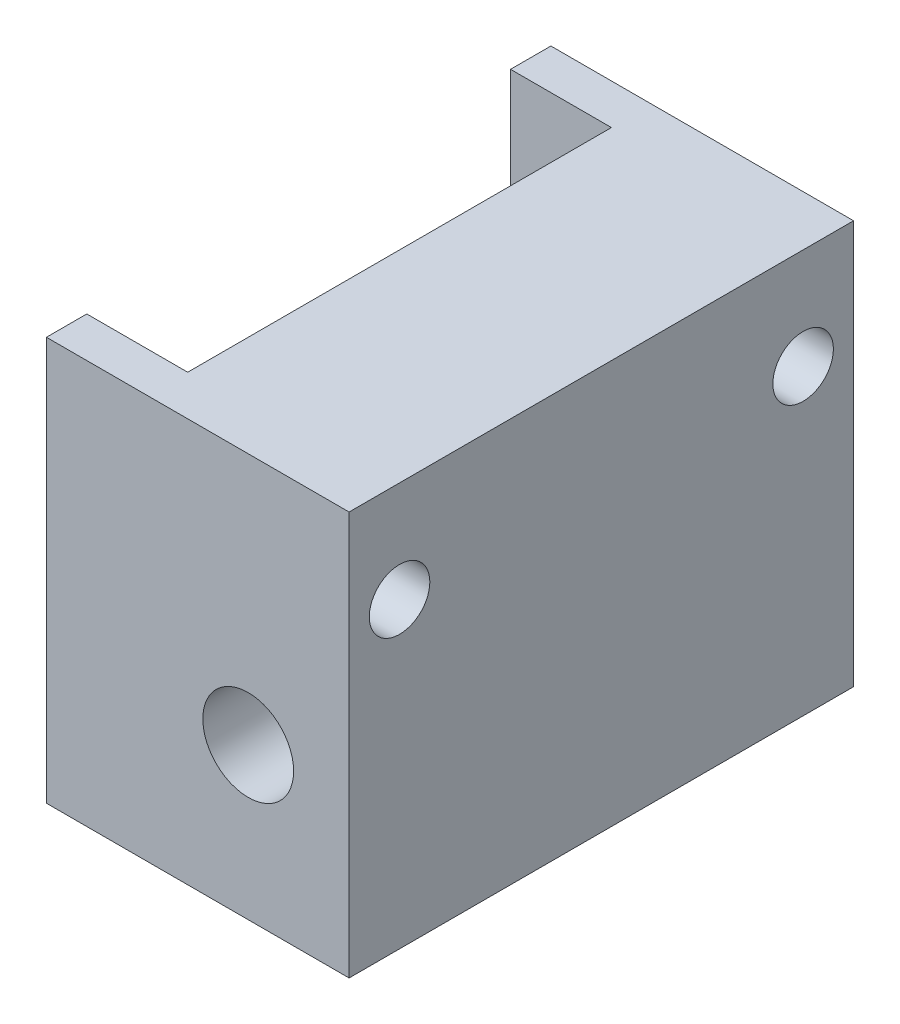
from build123d import *

# Parameters (mm, degrees)
SKETCH3_W           = 20
SKETCH3_H           = 50
BOSS_EXTRUDE1_DEPTH = 40
SKETCH4_R           = 4.5
CUT_EXTRUDE1_DEPTH  = 60
SKETCH5_R           = 3
CUT_EXTRUDE2_DEPTH  = 60
SKETCH6_W           = 4
SKETCH6_H           = 40
BOSS_EXTRUDE2_DEPTH = 10


with BuildPart() as part:
    # Sketch3 → Boss-Extrude1 (new body)
    with BuildSketch(Plane(origin=(0, 0, 0), x_dir=(1, 0, 0), z_dir=(0, 1, 0))):
        with Locations((-3.806451613, -14.790322581)):
            Rectangle(SKETCH3_W, SKETCH3_H)
    extrude(amount=BOSS_EXTRUDE1_DEPTH)

    # Sketch4 → Cut-Extrude1 (cut)
    with BuildSketch(Plane.XY.offset(39.790322581)):
        with Locations((-3.806451613, 15)):
            Circle(SKETCH4_R)
    extrude(amount=-CUT_EXTRUDE1_DEPTH, mode=Mode.SUBTRACT)

    # Sketch5 → Cut-Extrude2 (cut)
    with BuildSketch(Plane(origin=(6.193548387, 0, 0), x_dir=(0, 0, -1), z_dir=(1, 0, 0))):
        with Locations((-34.790322581, 30)):
            Circle(SKETCH5_R)
        with Locations((5.209677419, 30)):
            Circle(SKETCH5_R)
    extrude(amount=-CUT_EXTRUDE2_DEPTH, mode=Mode.SUBTRACT)

    # Sketch6 → Boss-Extrude2 (add)
    with BuildSketch(Plane.ZY.offset(13.806451613)):
        with Locations((-8.209677419, 20)):
            Rectangle(SKETCH6_W, SKETCH6_H)
        with Locations((37.790322581, 20)):
            Rectangle(SKETCH6_W, SKETCH6_H)
    extrude(amount=BOSS_EXTRUDE2_DEPTH)


solid = part.part
